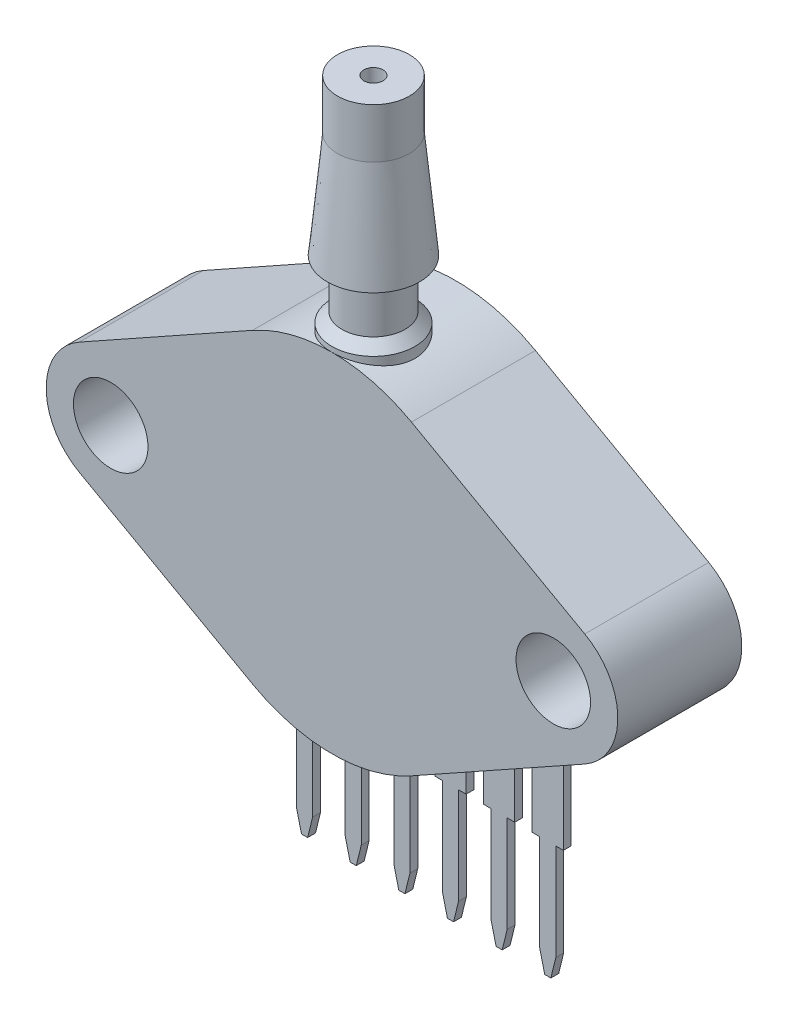
from build123d import *

# Parameters (mm, degrees)
EXTRUDE6_DEPTH               = 3.162924
EXTRUDE6_2_DEPTH             = 3.162924
EXTRUDE6_3_DEPTH             = 3.162924
EXTRUDE6_4_DEPTH             = 3.162924
EXTRUDE6_5_DEPTH             = 3.162924
EXTRUDE6_6_DEPTH             = 3.162924
EXTRUDE7_START               = -2.752923646
EXTRUDE7_DEPTH               = 2.752923646
EXTRUDE1_DEPTH               = 2.165
EXTRUDE1_DEPTH_BACK          = 6.095
SKETCH3_R                    = 1.945
F_1_0_1_DIAMETER_HOLE1_D     = 1
F_1_0_1_DIAMETER_HOLE1_DEPTH = 13.97
F_1_0_1_DIAMETER_HOLE1_TIP   = 0.30043031


# Read off the part's stored shape, not the designer's step: Extrude7
with BuildPart() as part:
    # Sketch7 → Extrude6 (new body)
    with BuildSketch(Plane.XY):
        with BuildLine():
            Line((-5.535, -12.32), (-5.535, -7.224956165))
            Line((-5.535, -7.224956165), (-7.165, -6.314002227))
            Line((-7.165, -6.314002227), (-7.165, -7.17281133))
            ThreePointArc((-7.165, -7.17281133), (-6.454703172, -7.883108158), (-7.165, -8.593404986))
            Line((-7.165, -8.593404986), (-7.165, -12.32))
            Line((-7.165, -12.32), (-6.77, -12.32))
            Line((-6.77, -12.32), (-6.77, -17.360738904))
            Line((-6.77, -17.360738904), (-6.510329667, -18.42))
            Line((-6.510329667, -18.42), (-6.189670333, -18.42))
            Line((-6.189670333, -18.42), (-5.93, -17.360738904))
            Line((-5.93, -17.360738904), (-5.93, -12.32))
            Line((-5.93, -12.32), (-5.535, -12.32))
        make_face()
    extrude(amount=-EXTRUDE6_DEPTH)


with BuildPart() as body_2:
    # Sketch7 → Extrude6 2 (new body)
    with BuildSketch(Plane.XY):
        with BuildLine():
            Line((-4.625, -7.733525542), (-4.625, -12.32))
            Line((-4.625, -12.32), (-4.23, -12.32))
            Line((-4.23, -12.32), (-4.23, -17.360738904))
            Line((-4.23, -17.360738904), (-3.970329667, -18.42))
            Line((-3.970329667, -18.42), (-3.649670333, -18.42))
            Line((-3.649670333, -18.42), (-3.39, -17.360738904))
            Line((-3.39, -17.360738904), (-3.39, -12.32))
            Line((-3.39, -12.32), (-2.995, -12.32))
            Line((-2.995, -12.32), (-2.995, -8.535310619))
            ThreePointArc((-2.995, -8.535310619), (-3.582478148, -8.288826526), (-4.149861063, -7.999065227))
            Line((-4.149861063, -7.999065227), (-4.625, -7.733525542))
        make_face()
    extrude(amount=-EXTRUDE6_2_DEPTH)


with BuildPart() as body_3:
    # Sketch7 → Extrude6 3 (new body)
    with BuildSketch(Plane.XY):
        with BuildLine():
            Line((-0.455, -12.32), (-0.455, -9.067822531))
            ThreePointArc((-0.455, -9.067822531), (-1.276005531, -8.983751864), (-2.085, -8.82051612))
            Line((-2.085, -8.82051612), (-2.085, -12.32))
            Line((-2.085, -12.32), (-1.69, -12.32))
            Line((-1.69, -12.32), (-1.69, -17.360738904))
            Line((-1.69, -17.360738904), (-1.430329667, -18.42))
            Line((-1.430329667, -18.42), (-1.109670333, -18.42))
            Line((-1.109670333, -18.42), (-0.85, -17.360738904))
            Line((-0.85, -17.360738904), (-0.85, -12.32))
            Line((-0.85, -12.32), (-0.455, -12.32))
        make_face()
    extrude(amount=-EXTRUDE6_3_DEPTH)


with BuildPart() as body_4:
    # Sketch7 → Extrude6 4 (new body)
    with BuildSketch(Plane.XY):
        with BuildLine():
            Line((4.625, -12.32), (4.625, -7.733525542))
            Line((4.625, -7.733525542), (4.149861063, -7.999065227))
            ThreePointArc((4.149861063, -7.999065227), (3.582478148, -8.288826526), (2.995, -8.535310619))
            Line((2.995, -8.535310619), (2.995, -12.32))
            Line((2.995, -12.32), (3.39, -12.32))
            Line((3.39, -12.32), (3.39, -17.360738904))
            Line((3.39, -17.360738904), (3.649670333, -18.42))
            Line((3.649670333, -18.42), (3.970329667, -18.42))
            Line((3.970329667, -18.42), (4.23, -17.360738904))
            Line((4.23, -17.360738904), (4.23, -12.32))
            Line((4.23, -12.32), (4.625, -12.32))
        make_face()
    extrude(amount=-EXTRUDE6_4_DEPTH)


with BuildPart() as body_5:
    # Sketch7 → Extrude6 5 (new body)
    with BuildSketch(Plane.XY):
        with BuildLine():
            Line((0.455, -9.067822531), (0.455, -12.32))
            Line((0.455, -12.32), (0.85, -12.32))
            Line((0.85, -12.32), (0.85, -17.360738904))
            Line((0.85, -17.360738904), (1.109670333, -18.42))
            Line((1.109670333, -18.42), (1.430329667, -18.42))
            Line((1.430329667, -18.42), (1.69, -17.360738904))
            Line((1.69, -17.360738904), (1.69, -12.32))
            Line((1.69, -12.32), (2.085, -12.32))
            Line((2.085, -12.32), (2.085, -8.82051612))
            ThreePointArc((2.085, -8.82051612), (1.276005531, -8.983751864), (0.455, -9.067822531))
        make_face()
    extrude(amount=-EXTRUDE6_5_DEPTH)


with BuildPart() as body_6:
    # Sketch7 → Extrude6 6 (new body)
    with BuildSketch(Plane.XY):
        Polygon((5.535, -7.224956165), (5.535, -12.32), (5.93, -12.32), (5.93, -17.360738904), (6.189670333, -18.42), (6.510329667, -18.42), (6.77, -17.360738904), (6.77, -12.32), (7.165, -12.32), (7.165, -6.314002227), align=None)
    extrude(amount=-EXTRUDE6_6_DEPTH)


with BuildPart() as extrude7_tool:
    # Extrude7 outline → Extrude7 (new body)
    with BuildSketch(Plane.XY.offset(EXTRUDE7_START)):
        with BuildLine():
            Line((-5.93, -17.360738904), (-5.93, -12.32))
            Line((-5.93, -12.32), (-5.535, -12.32))
            Line((-5.535, -12.32), (-5.535, -7.224956165))
            Line((-5.535, -7.224956165), (-7.165, -6.314002227))
            Line((-7.165, -6.314002227), (-7.165, -7.17281133))
            ThreePointArc((-7.165, -7.17281133), (-6.454703172, -7.883108158), (-7.165, -8.593404986))
            Line((-7.165, -8.593404986), (-7.165, -12.32))
            Line((-7.165, -12.32), (-6.77, -12.32))
            Line((-6.77, -12.32), (-6.77, -17.360738904))
            Line((-6.77, -17.360738904), (-6.510329667, -18.42))
            Line((-6.510329667, -18.42), (-6.189670333, -18.42))
            Line((-6.189670333, -18.42), (-5.93, -17.360738904))
        make_face()
        Polygon((6.77, -17.360738904), (6.77, -12.32), (7.165, -12.32), (7.165, -6.314002227), (5.535, -7.224956165), (5.535, -12.32), (5.93, -12.32), (5.93, -17.360738904), (6.189670333, -18.42), (6.510329667, -18.42), align=None)
        with BuildLine():
            Line((4.23, -17.360738904), (4.23, -12.32))
            Line((4.23, -12.32), (4.625, -12.32))
            Line((4.625, -12.32), (4.625, -7.733525542))
            Line((4.625, -7.733525542), (4.149861063, -7.999065227))
            ThreePointArc((4.149861063, -7.999065227), (3.582478148, -8.288826526), (2.995, -8.535310619))
            Line((2.995, -8.535310619), (2.995, -12.32))
            Line((2.995, -12.32), (3.39, -12.32))
            Line((3.39, -12.32), (3.39, -17.360738904))
            Line((3.39, -17.360738904), (3.649670333, -18.42))
            Line((3.649670333, -18.42), (3.970329667, -18.42))
            Line((3.970329667, -18.42), (4.23, -17.360738904))
        make_face()
        with BuildLine():
            Line((1.69, -17.360738904), (1.69, -12.32))
            Line((1.69, -12.32), (2.085, -12.32))
            Line((2.085, -12.32), (2.085, -8.82051612))
            ThreePointArc((2.085, -8.82051612), (1.276005531, -8.983751864), (0.455, -9.067822531))
            Line((0.455, -9.067822531), (0.455, -12.32))
            Line((0.455, -12.32), (0.85, -12.32))
            Line((0.85, -12.32), (0.85, -17.360738904))
            Line((0.85, -17.360738904), (1.109670333, -18.42))
            Line((1.109670333, -18.42), (1.430329667, -18.42))
            Line((1.430329667, -18.42), (1.69, -17.360738904))
        make_face()
        with BuildLine():
            Line((-0.85, -17.360738904), (-0.85, -12.32))
            Line((-0.85, -12.32), (-0.455, -12.32))
            Line((-0.455, -12.32), (-0.455, -9.067822531))
            ThreePointArc((-0.455, -9.067822531), (-1.276005531, -8.983751864), (-2.085, -8.82051612))
            Line((-2.085, -8.82051612), (-2.085, -12.32))
            Line((-2.085, -12.32), (-1.69, -12.32))
            Line((-1.69, -12.32), (-1.69, -17.360738904))
            Line((-1.69, -17.360738904), (-1.430329667, -18.42))
            Line((-1.430329667, -18.42), (-1.109670333, -18.42))
            Line((-1.109670333, -18.42), (-0.85, -17.360738904))
        make_face()
        with BuildLine():
            Line((-3.39, -17.360738904), (-3.39, -12.32))
            Line((-3.39, -12.32), (-2.995, -12.32))
            Line((-2.995, -12.32), (-2.995, -8.535310619))
            ThreePointArc((-2.995, -8.535310619), (-3.582478148, -8.288826526), (-4.149861063, -7.999065227))
            Line((-4.149861063, -7.999065227), (-4.625, -7.733525542))
            Line((-4.625, -7.733525542), (-4.625, -12.32))
            Line((-4.625, -12.32), (-4.23, -12.32))
            Line((-4.23, -12.32), (-4.23, -17.360738904))
            Line((-4.23, -17.360738904), (-3.970329667, -18.42))
            Line((-3.970329667, -18.42), (-3.649670333, -18.42))
            Line((-3.649670333, -18.42), (-3.39, -17.360738904))
        make_face()
    extrude(amount=EXTRUDE7_DEPTH)


with BuildPart() as part_1:
    add(part.part)

    # Extrude7: cut by extrude7_tool
    add(extrude7_tool.part, mode=Mode.SUBTRACT)



with BuildPart() as body_2_1:
    add(body_2.part)

    # Extrude7: cut by extrude7_tool
    add(extrude7_tool.part, mode=Mode.SUBTRACT)


with BuildPart() as body_3_1:
    add(body_3.part)

    # Extrude7: cut by extrude7_tool
    add(extrude7_tool.part, mode=Mode.SUBTRACT)


with BuildPart() as body_4_1:
    add(body_4.part)

    # Extrude7: cut by extrude7_tool
    add(extrude7_tool.part, mode=Mode.SUBTRACT)


with BuildPart() as body_5_1:
    add(body_5.part)

    # Extrude7: cut by extrude7_tool
    add(extrude7_tool.part, mode=Mode.SUBTRACT)


with BuildPart() as body_6_1:
    add(body_6.part)

    # Extrude7: cut by extrude7_tool
    add(extrude7_tool.part, mode=Mode.SUBTRACT)


with BuildPart() as part_2:
    add(part_1.part)

    add(body_2_1.part)  # Extrude1 merges body 2

    add(body_3_1.part)  # Extrude1 merges body 3

    add(body_4_1.part)  # Extrude1 merges body 4

    add(body_5_1.part)  # Extrude1 merges body 5

    add(body_6_1.part)  # Extrude1 merges body 6
    # Sketch3 → Extrude1 (add, two sides: drawn at the far end of the back side and taken through both)
    with BuildSketch(Plane.XY.offset(-EXTRUDE1_DEPTH_BACK)):
        with BuildLine():
            Line((4.149861063, -7.999065227), (13.199056425, -2.941764516))
            ThreePointArc((13.199056425, -2.941764516), (14.925, 0), (13.199056425, 2.941764516))
            Line((13.199056425, 2.941764516), (4.149861063, 7.999065227))
            ThreePointArc((4.149861063, 7.999065227), (0, 9.08), (-4.149861063, 7.999065227))
            Line((-4.149861063, 7.999065227), (-13.199056425, 2.941764516))
            ThreePointArc((-13.199056425, 2.941764516), (-14.925, 0), (-13.199056425, -2.941764516))
            Line((-13.199056425, -2.941764516), (-4.149861063, -7.999065227))
            ThreePointArc((-4.149861063, -7.999065227), (0, -9.08), (4.149861063, -7.999065227))
        make_face()
        with Locations((11.555, 0)):
            Circle(SKETCH3_R, mode=Mode.SUBTRACT)
        with Locations((-11.555, 0)):
            Circle(SKETCH3_R, mode=Mode.SUBTRACT)
    extrude(amount=EXTRUDE1_DEPTH + EXTRUDE1_DEPTH_BACK)

    # Sketch5 → Cut-Revolve1 (revolve, cut)
    with BuildSketch(Plane(origin=(0, 0, 0), x_dir=(0, 0, -1), z_dir=(1, 0, 0)), mode=Mode.PRIVATE) as cut_revolve1_sk:
        Polygon((4.310187736, -16.063245386), (4.310187736, -7.724967149), (6.095, -6.063245386), (6.095, -16.063245386), align=None)
    revolve(cut_revolve1_sk.sketch.rotate(Axis((0, 0, 0), (0, 0, 1)), 270), axis=Axis((0, 0, 0), (0, 0, 1)), mode=Mode.SUBTRACT)

    # Sketch8 → Revolve1 (revolve)
    with BuildSketch(Plane(origin=(0, 0, 0), x_dir=(0, 0, -1), z_dir=(1, 0, 0)), mode=Mode.PRIVATE) as revolve1_sk:
        Polygon((0, 0), (0, 20.522309629), (-1.878035446, 20.522309629), (-1.878035446, 17.921716672), (-2.411490412, 12.387121404), (-1.649027846, 12.387121404), (-1.649027846, 9.857883061), (-2.165, 9.342309629), (-2.165, 0), align=None)
    revolve(revolve1_sk.sketch.rotate(Axis((0, 20.522309629, 0), (0, 1, 0)), 180), axis=Axis((0, 20.522309629, 0), (0, 1, 0)))

    # Ø1.0 (1) Diameter Hole1
    with Locations(Plane.ZX.offset(20.522309629)):
        with Locations((0, 0)):
            Hole(F_1_0_1_DIAMETER_HOLE1_D / 2, depth=F_1_0_1_DIAMETER_HOLE1_DEPTH)
            with Locations((0, 0, -(F_1_0_1_DIAMETER_HOLE1_DEPTH + F_1_0_1_DIAMETER_HOLE1_TIP / 2))):  # 118° drill point
                Cone(0, F_1_0_1_DIAMETER_HOLE1_D / 2, F_1_0_1_DIAMETER_HOLE1_TIP, mode=Mode.SUBTRACT)


solid = part_2.part
